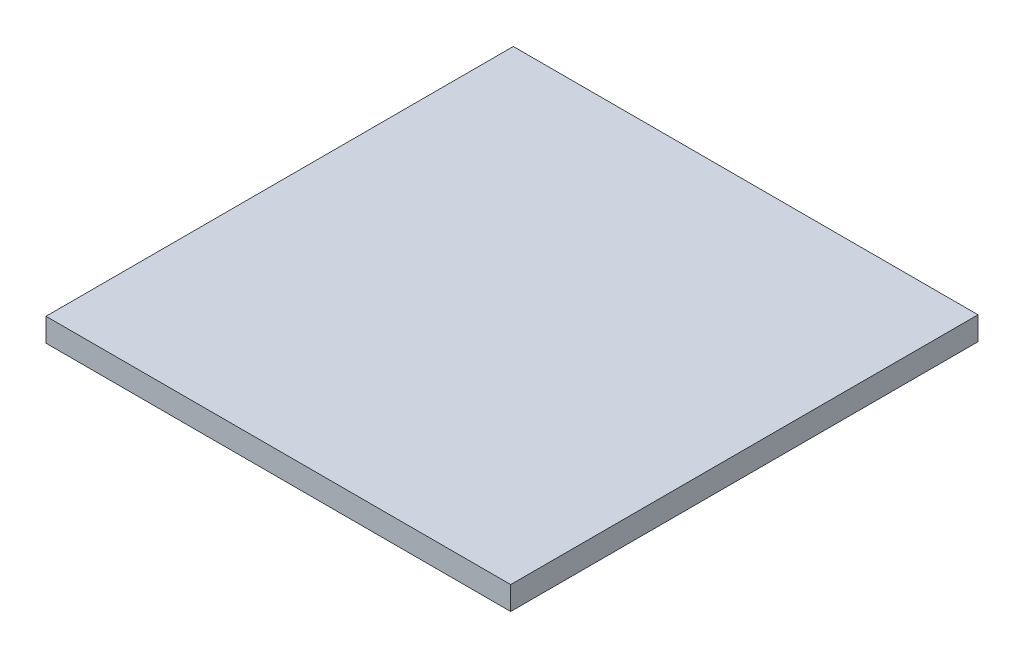
from build123d import *

# Parameters (mm, degrees)
CROQUIS1_W              = 358
CROQUIS1_H              = 360
SALIENTE_EXTRUIR1_DEPTH = 18


with BuildPart() as part:
    # Croquis1 → Saliente-Extruir1 (new body)
    with BuildSketch(Plane(origin=(0, 0, 0), x_dir=(1, 0, 0), z_dir=(0, 1, 0))):
        Rectangle(CROQUIS1_W, CROQUIS1_H)
    extrude(amount=SALIENTE_EXTRUIR1_DEPTH)


solid = part.part
